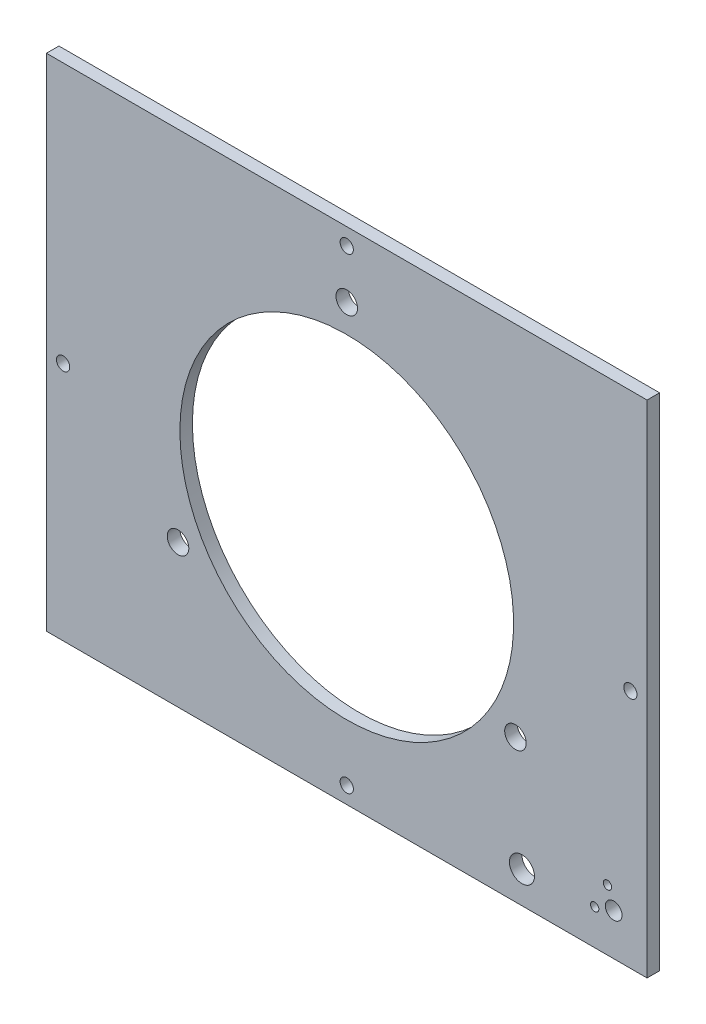
from build123d import *

# Parameters (mm, degrees)
SKETCH1_R                   = 127
SKETCH1_R_2                 = 8.198770857
SKETCH1_R_3                 = 6.35
SKETCH1_R_4                 = 3.175
SKETCH1_R_5                 = 9.525
BOSS_EXTRUDE1_DEPTH         = 9.525
F_3_8_CLEARANCE_HOLE1_D     = 10.0838
F_3_8_CLEARANCE_HOLE1_DEPTH = 25.4
F_3_8_CLEARANCE_HOLE1_TIP   = 3.029479155


with BuildPart() as part:
    # Sketch1 → Boss-Extrude1 (new body)
    with BuildSketch(Plane.XY):
        Polygon((-228.6, -30.48), (-228.6, -182.88), (228.6, -182.88), (228.6, -30.48), (228.6, 198.12), (-228.6, 198.12), align=None)
        Circle(SKETCH1_R, mode=Mode.SUBTRACT)
        with Locations((0, 148.2852)):
            Circle(SKETCH1_R_2, mode=Mode.SUBTRACT)
        with Locations((128.418750205, -74.1426)):
            Circle(SKETCH1_R_2, mode=Mode.SUBTRACT)
        with Locations((-128.418750205, -74.1426)):
            Circle(SKETCH1_R_2, mode=Mode.SUBTRACT)
        with Locations((203.2, -151.13)):
            Circle(SKETCH1_R_3, mode=Mode.SUBTRACT)
        with Locations((188.723253344, -155.8925)):
            Circle(SKETCH1_R_4, mode=Mode.SUBTRACT)
        with Locations((198.4375, -136.653253344)):
            Circle(SKETCH1_R_4, mode=Mode.SUBTRACT)
        with Locations((133.35, -158.75)):
            Circle(SKETCH1_R_5, mode=Mode.SUBTRACT)
    extrude(amount=BOSS_EXTRUDE1_DEPTH)

    # 3/8 Clearance Hole1
    with Locations(Plane.XY.offset(9.525)):
        with Locations((0, 185.42), (-215.9, 0), (0, -170.18), (215.9, 0)):
            Hole(F_3_8_CLEARANCE_HOLE1_D / 2, depth=F_3_8_CLEARANCE_HOLE1_DEPTH)
            with Locations((0, 0, -(F_3_8_CLEARANCE_HOLE1_DEPTH + F_3_8_CLEARANCE_HOLE1_TIP / 2))):  # 118° drill point
                Cone(0, F_3_8_CLEARANCE_HOLE1_D / 2, F_3_8_CLEARANCE_HOLE1_TIP, mode=Mode.SUBTRACT)


solid = part.part
